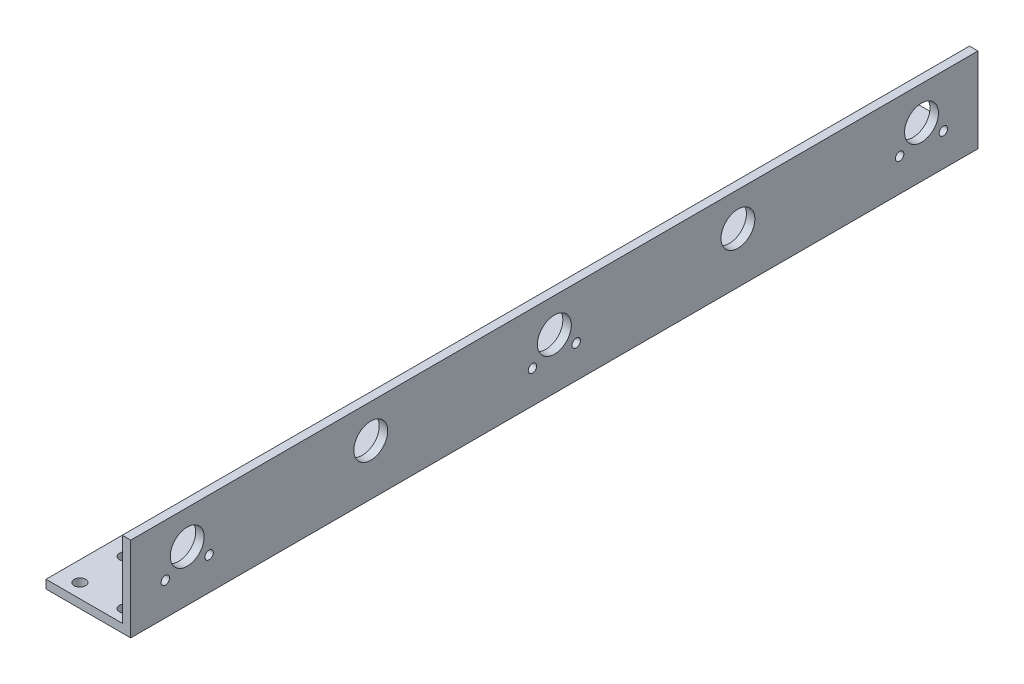
from build123d import *

# Parameters (mm, degrees)
EXTRUDE_1_DEPTH     = 300
SKETCH_2_R          = 6
CUT_EXTRUDE_1_DEPTH = 300
SKETCH_3_R          = 2
CUT_EXTRUDE_2_DEPTH = 300
SKETCH_4_R          = 1.5
CUT_EXTRUDE_3_DEPTH = 10


with BuildPart() as part:
    # 草图1 → 凸台-拉伸1 (new body)
    with BuildSketch(Plane.XY):
        Polygon((-15, -15), (15, -15), (15, 15), (12, 15), (12, -12), (-15, -12), align=None)
    extrude(amount=EXTRUDE_1_DEPTH)

    # 草图2 → 切除-拉伸1 (cut)
    with BuildSketch(Plane.ZY.offset(-12)):
        with Locations((20, 3)):
            Circle(SKETCH_2_R)
        with Locations((85, 3)):
            Circle(SKETCH_2_R)
        with Locations((150, 3)):
            Circle(SKETCH_2_R)
        with Locations((215, 3)):
            Circle(SKETCH_2_R)
        with Locations((280, 3)):
            Circle(SKETCH_2_R)
    extrude(amount=-CUT_EXTRUDE_1_DEPTH, mode=Mode.SUBTRACT)

    # 草图3 → 切除-拉伸2 (cut)
    with BuildSketch(Plane.XZ.offset(15)):
        with Locations((8, 5)):
            Circle(SKETCH_3_R)
        with Locations((-8, 5)):
            Circle(SKETCH_3_R)
        with Locations((-8, 21)):
            Circle(SKETCH_3_R)
        with Locations((8, 21)):
            Circle(SKETCH_3_R)
        with Locations((8, 295)):
            Circle(SKETCH_3_R)
        with Locations((8, 279)):
            Circle(SKETCH_3_R)
        with Locations((-8, 279)):
            Circle(SKETCH_3_R)
        with Locations((-8, 295)):
            Circle(SKETCH_3_R)
    extrude(amount=-CUT_EXTRUDE_2_DEPTH, mode=Mode.SUBTRACT)

    # 草图4 → 切除-拉伸3 (cut)
    with BuildSketch(Plane(origin=(15, 0, 0), x_dir=(0, 0, -1), z_dir=(1, 0, 0))):
        with Locations((-27.75, -3.423393759)):
            Circle(SKETCH_4_R)
        with Locations((-12.25, -3.423393759)):
            Circle(SKETCH_4_R)
        with Locations((-272.25, -3.423393759)):
            Circle(SKETCH_4_R)
        with Locations((-287.75, -3.423393759)):
            Circle(SKETCH_4_R)
        with Locations((-142.25, -3.423393759)):
            Circle(SKETCH_4_R)
        with Locations((-157.75, -3.423393759)):
            Circle(SKETCH_4_R)
    extrude(amount=-CUT_EXTRUDE_3_DEPTH, mode=Mode.SUBTRACT)


solid = part.part
